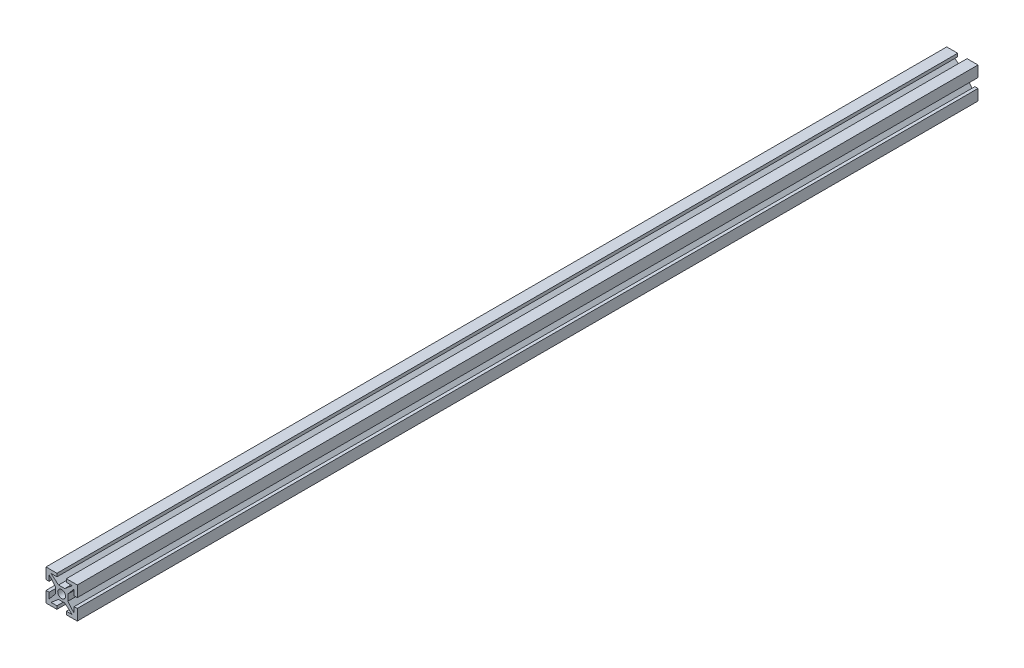
from build123d import *

# Parameters (mm, degrees)
ESQUISSE2_R          = 1.25
MAIN_EXTRUSION_DEPTH = 288


with BuildPart() as part:
    # Esquisse2 → Main Extrusion (new body)
    with BuildSketch(Plane.XY):
        Polygon((-1, -2), (1, -2), (3.383507185, -4), (1.5, -4), (1.5, -5), (5, -5), (5, -1.5), (4, -1.5), (4, -3.383507185), (2, -1), (2, 1), (4, 3.383507185), (4, 1.5), (5, 1.5), (5, 5), (1.5, 5), (1.5, 4), (3.383507185, 4), (1, 2), (-1, 2), (-3.383507185, 4), (-1.5, 4), (-1.5, 5), (-5, 5), (-5, 1.5), (-4, 1.5), (-4, 3.383507185), (-2, 1), (-2, -1), (-4, -3.383507185), (-4, -1.5), (-5, -1.5), (-5, -5), (-1.5, -5), (-1.5, -4), (-3.383507185, -4), align=None)
        Circle(ESQUISSE2_R, mode=Mode.SUBTRACT)
    extrude(amount=MAIN_EXTRUSION_DEPTH)


solid = part.part
